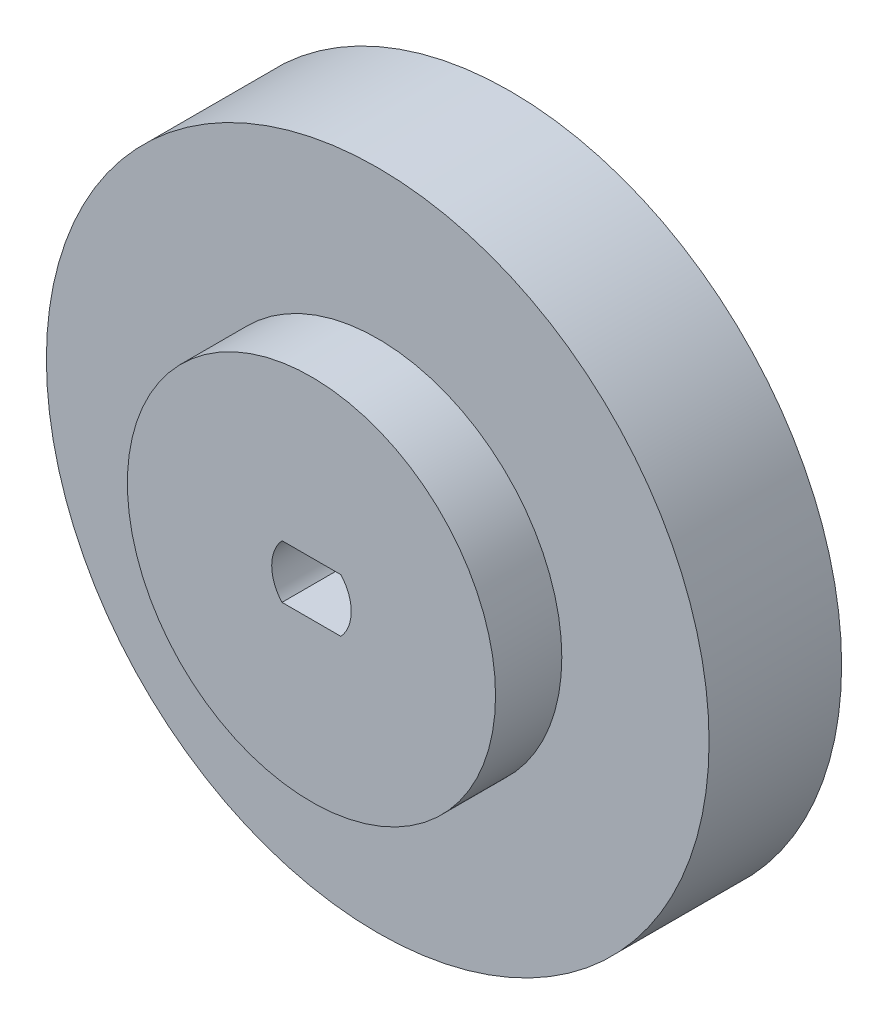
from build123d import *

# Parameters (mm, degrees)
SKETCH1_R           = 12.5
BOSS_EXTRUDE1_DEPTH = 18
BOSS_EXTRUDE2_START = -4.5
SKETCH2_R           = 22.5
BOSS_EXTRUDE2_DEPTH = 9
CUT_EXTRUDE1_DEPTH  = 37.558172821


with BuildPart() as part:
    # Sketch1 → Boss-Extrude1 (new body)
    with BuildSketch(Plane.XY):
        with Locations((0, -0.049046118)):
            Circle(SKETCH1_R)
    extrude(amount=BOSS_EXTRUDE1_DEPTH)

    # Sketch2 → Boss-Extrude2 (add)
    with BuildSketch(Plane.XY.offset(18).offset(BOSS_EXTRUDE2_START)):
        Circle(SKETCH2_R)
    extrude(amount=-BOSS_EXTRUDE2_DEPTH)

    # Sketch3 → Cut-Extrude1 (cut, through all)
    with BuildSketch(Plane.XY.offset(18)):
        with BuildLine():
            Line((-2, 1.813835715), (2, 1.813835715))
            ThreePointArc((2, 1.813835715), (2.7, 0), (2, -1.813835715))
            Line((2, -1.813835715), (-2, -1.813835715))
            ThreePointArc((-2, -1.813835715), (-2.7, 0), (-2, 1.813835715))
        make_face()
    extrude(amount=-CUT_EXTRUDE1_DEPTH, mode=Mode.SUBTRACT)


solid = part.part
